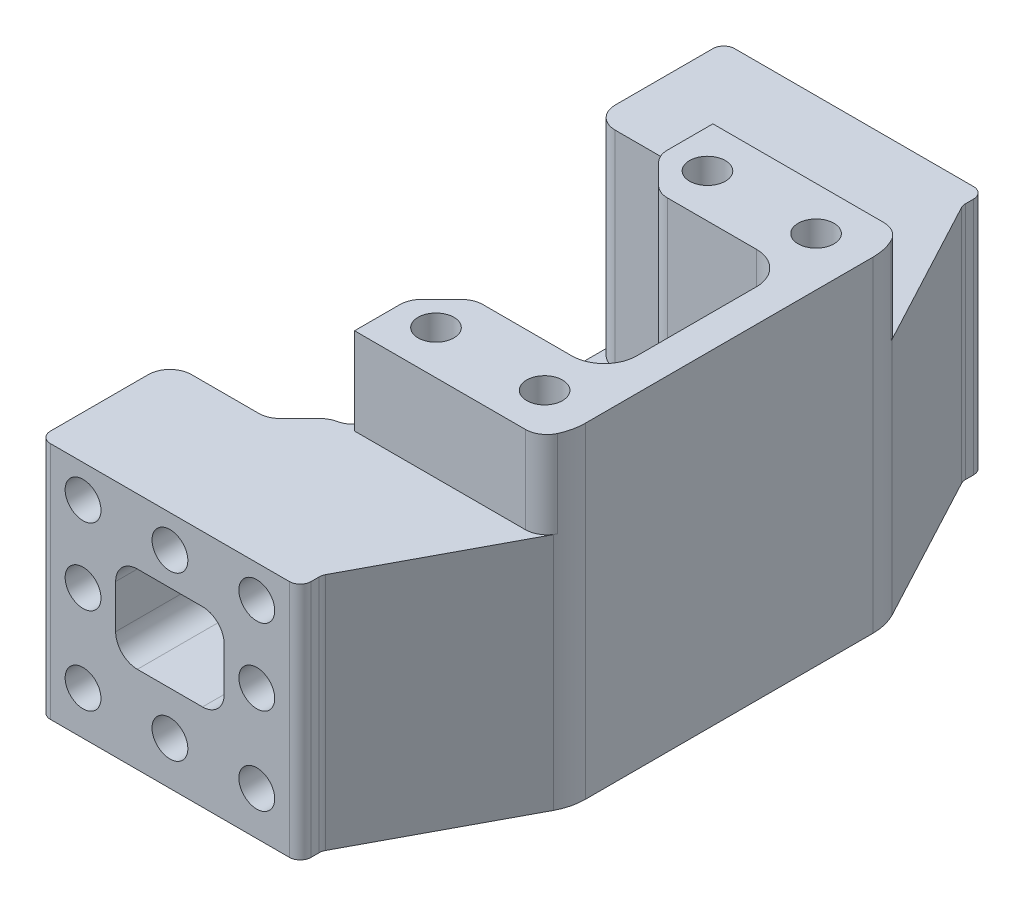
from build123d import *

# Parameters (mm, degrees)
SKETCH_1_W           = 25
SKETCH_1_H           = 25
EXTRUDE_1_DEPTH      = 59
SKETCH_2_R           = 1.65
CUT_EXTRUDE_1_DEPTH  = 10
CUT_EXTRUDE_START    = -10
SKETCH_3_R           = 1.65
CUT_EXTRUDE_2_DEPTH  = 10
SKETCH_4_R           = 1.65
CUT_EXTRUDE_3_DEPTH  = 30
SKETCH_7_W           = 51
SKETCH_7_H           = 17
CUT_EXTRUDE_5_DEPTH  = 2
SKETCH_8_W           = 18
SKETCH_8_H           = 17
CUT_EXTRUDE_6_DEPTH  = 36
SKETCH_10_R          = 1.65
SKETCH_10_W          = 18
SKETCH_10_H          = 17
CUT_EXTRUDE_8_DEPTH  = 4
SKETCH_13_W          = 2
SKETCH_13_H          = 9
CUT_EXTRUDE_11_DEPTH = 4
SKETCH_15_W          = 5
SKETCH_15_H          = 33
CUT_EXTRUDE_13_DEPTH = 8
CHAMFER_1_SIZE       = 3
FILLET_7_R           = 1
SKETCH_17_W          = 2
SKETCH_17_H          = 61.49877521
CUT_EXTRUDE_15_DEPTH = 32
SKETCH_18_W          = 23
SKETCH_18_H          = 59
CUT_EXTRUDE_16_DEPTH = 10
EXTRUDE_START        = -10
SKETCH_19_R          = 1.65
EXTRUDE_2_DEPTH      = 10
SKETCH_20_R          = 1.65
EXTRUDE_3_DEPTH      = 10
SKETCH_23_R          = 1.65
CUT_EXTRUDE_17_DEPTH = 10
SKETCH_24_R          = 1.65
CUT_EXTRUDE_18_DEPTH = 10
CUT_EXTRUDE_19_DEPTH = 30
FILLET_9_R           = 5
FILLET_10_R          = 3
EXTRUDE_4_DEPTH      = 9
SKETCH_26_R          = 1.65
CUT_EXTRUDE_20_DEPTH = 8
CUT_EXTRUDE_START_2  = -8
SKETCH_27_R          = 1.65
CUT_EXTRUDE_21_DEPTH = 8
EXTRUDE_START_2      = 2
SKETCH_28_W          = 24
SKETCH_28_H          = 15
SKETCH_28_R          = 1.65
EXTRUDE_5_DEPTH      = 2
SKETCH_29_W          = 24
SKETCH_29_H          = 15
SKETCH_29_R          = 1.65
EXTRUDE_6_DEPTH      = 2
FILLET_11_R          = 2
FILLET_13_R          = 1
SKETCH_30_R          = 1.65
EXTRUDE_7_DEPTH      = 19
FILLET_START         = 12.5
FILLET_14_DEPTH      = 15.5
FILLET_START_2       = -2.5
FILLET_14_2_DEPTH    = 15
EXTRUDE_8_DEPTH      = 7
SKETCH_33_R          = 1.65
CUT_EXTRUDE_22_DEPTH = 10
SKETCH_34_W          = 10
SKETCH_34_H          = 8
CUT_EXTRUDE_23_DEPTH = 10
SKETCH_35_R          = 1.65
SKETCH_35_W          = 10
SKETCH_35_H          = 8
CUT_EXTRUDE_24_DEPTH = 10
FILLET_15_R          = 2


with BuildPart() as part:
    # 草图1 → 凸台-拉伸1 (new body)
    with BuildSketch(Plane.XY):
        Rectangle(SKETCH_1_W, SKETCH_1_H)
    extrude(amount=EXTRUDE_1_DEPTH)

    # 草图2 → 切除-拉伸1 (cut)
    with BuildSketch(Plane(origin=(0, 0, 0), x_dir=(-1, 0, 0), z_dir=(0, 0, -1))):
        with Locations((7.5, 8.5)):
            Circle(SKETCH_2_R)
        with Locations((7.5, -3.5)):
            Circle(SKETCH_2_R)
        with Locations((-0.5, -3.5)):
            Circle(SKETCH_2_R)
        with Locations((-0.5, 8.5)):
            Circle(SKETCH_2_R)
    extrude(amount=-CUT_EXTRUDE_1_DEPTH, mode=Mode.SUBTRACT)

    # 草图3 → 切除-拉伸2 (cut)
    with BuildSketch(Plane.XY.offset(59).offset(CUT_EXTRUDE_START)):
        with Locations(Location((0.5, -3.5, 0), (0, 0, 180))):
            Circle(SKETCH_3_R)
        with Locations(Location((-7.5, -3.5, 0), (0, 0, 180))):
            Circle(SKETCH_3_R)
        with Locations(Location((-7.5, 8.5, 0), (0, 0, 180))):
            Circle(SKETCH_3_R)
        with Locations(Location((0.5, 8.5, 0), (0, 0, 180))):
            Circle(SKETCH_3_R)
    extrude(amount=CUT_EXTRUDE_2_DEPTH, mode=Mode.SUBTRACT)

    # 草图4 → 切除-拉伸3 (cut)
    with BuildSketch(Plane(origin=(0, 12.5, 0), x_dir=(1, 0, 0), z_dir=(0, 1, 0))):
        with Locations(Location((8, -17, 0), (0, 0, 270))):
            Circle(SKETCH_4_R)
        with Locations(Location((-2, -17, 0), (0, 0, 270))):
            Circle(SKETCH_4_R)
        with Locations(Location((-2, -42, 0), (0, 0, 270))):
            Circle(SKETCH_4_R)
        with Locations(Location((8, -42, 0), (0, 0, 270))):
            Circle(SKETCH_4_R)
    extrude(amount=-CUT_EXTRUDE_3_DEPTH, mode=Mode.SUBTRACT)

    # 草图7 → 切除-拉伸5 (cut)
    with BuildSketch(Plane.ZY.offset(12.5)):
        with Locations((29.5, 0)):
            Rectangle(SKETCH_7_W, SKETCH_7_H)
    extrude(amount=-CUT_EXTRUDE_5_DEPTH, mode=Mode.SUBTRACT)

    # 草图8 → 切除-拉伸6 (cut)
    with BuildSketch(Plane(origin=(0, 12.5, 0), x_dir=(1, 0, 0), z_dir=(0, 1, 0))):
        with Locations((0.5, -29.5)):
            Rectangle(SKETCH_8_W, SKETCH_8_H)
    extrude(amount=-CUT_EXTRUDE_6_DEPTH, mode=Mode.SUBTRACT)

    # 草图10 → 切除-拉伸8 (cut)
    with BuildSketch(Plane(origin=(0, 12.5, 0), x_dir=(1, 0, 0), z_dir=(0, 1, 0))):
        Polygon((-12.5, -13), (-12.5, -46), (11.433333333, -46), (12.5, -44), (12.5, -15), (11.433333333, -13), align=None)
        with Locations(Location((-2, -42, 0), (0, 0, 270))):
            Circle(SKETCH_10_R, mode=Mode.SUBTRACT)
        with Locations(Location((8, -42, 0), (0, 0, 270))):
            Circle(SKETCH_10_R, mode=Mode.SUBTRACT)
        with Locations(Location((-2, -17, 0), (0, 0, 270))):
            Circle(SKETCH_10_R, mode=Mode.SUBTRACT)
        with Locations((0.5, -29.5)):
            Rectangle(SKETCH_10_W, SKETCH_10_H, mode=Mode.SUBTRACT)
        with Locations(Location((8, -17, 0), (0, 0, 270))):
            Circle(SKETCH_10_R, mode=Mode.SUBTRACT)
    extrude(amount=-CUT_EXTRUDE_8_DEPTH, mode=Mode.SUBTRACT)

    # 草图13 → 切除-拉伸11 (cut)
    with BuildSketch(Plane(origin=(0, 12.5, 0), x_dir=(1, 0, 0), z_dir=(0, 1, 0))):
        with Locations((-11.5, -50.5)):
            Rectangle(SKETCH_13_W, SKETCH_13_H)
        with Locations((-11.5, -8.5)):
            Rectangle(SKETCH_13_W, SKETCH_13_H)
    extrude(amount=-CUT_EXTRUDE_11_DEPTH, mode=Mode.SUBTRACT)

    # 草图15 → 切除-拉伸13 (cut)
    with BuildSketch(Plane(origin=(0, 8.5, 0), x_dir=(1, 0, 0), z_dir=(0, 1, 0))):
        with Locations((-8, -29.5)):
            Rectangle(SKETCH_15_W, SKETCH_15_H)
    extrude(amount=-CUT_EXTRUDE_13_DEPTH, mode=Mode.SUBTRACT)

    # 倒角1
    chamfer_1_edges = [part.edges().sort_by_distance(p)[0] for p in [
        (-10.5, 6.5, 46),
        (-10.5, 6.5, 13),
        (-5.5, 4.5, 21),
        (-5.5, 4.5, 38),
    ]]
    chamfer(chamfer_1_edges, length=CHAMFER_1_SIZE)

    # 圆角7
    fillet_7_edges = [part.edges().sort_by_distance(p)[0] for p in [
        (-5.5, 4.5, 13),
        (-5.5, 4.5, 46),
    ]]
    fillet(fillet_7_edges, radius=FILLET_7_R)

    # 草图17 → 切除-拉伸15 (cut)
    with BuildSketch(Plane(origin=(0, 12.5, 0), x_dir=(1, 0, 0), z_dir=(0, 1, 0))):
        with Locations((-11.5, -29.775532147)):
            Rectangle(SKETCH_17_W, SKETCH_17_H)
    extrude(amount=-CUT_EXTRUDE_15_DEPTH, mode=Mode.SUBTRACT)

    # 草图18 → 切除-拉伸16 (cut)
    with BuildSketch(Plane.XZ.offset(12.5)):
        with Locations((1, 29.5)):
            Rectangle(SKETCH_18_W, SKETCH_18_H)
    extrude(amount=-CUT_EXTRUDE_16_DEPTH, mode=Mode.SUBTRACT)

    # 草图19 → 凸台-拉伸2 (add)
    with BuildSketch(Plane.XY.offset(59).offset(EXTRUDE_START)):
        with Locations(Location((0.5, 8.5, 0), (0, 0, 180))):
            Circle(SKETCH_19_R)
        with Locations(Location((-7.5, 8.5, 0), (0, 0, 180))):
            Circle(SKETCH_19_R)
        with BuildLine():
            Line((-8.812440475, -2.5), (-6.187559525, -2.5))
            ThreePointArc((-6.187559525, -2.5), (-7.5, -1.85), (-8.812440475, -2.5))
        make_face()
        with BuildLine():
            Line((-0.812440475, -2.5), (1.812440475, -2.5))
            ThreePointArc((1.812440475, -2.5), (0.5, -1.85), (-0.812440475, -2.5))
        make_face()
    extrude(amount=EXTRUDE_2_DEPTH)

    # 草图20 → 凸台-拉伸3 (add)
    with BuildSketch(Plane(origin=(0, 0, 0), x_dir=(-1, 0, 0), z_dir=(0, 0, -1))):
        with Locations((7.5, 8.5)):
            Circle(SKETCH_20_R)
        with Locations((-0.5, 8.5)):
            Circle(SKETCH_20_R)
        with BuildLine():
            Line((-1.812440475, -2.5), (0.812440475, -2.5))
            ThreePointArc((0.812440475, -2.5), (-0.5, -1.85), (-1.812440475, -2.5))
        make_face()
        with BuildLine():
            Line((6.187559525, -2.5), (8.812440475, -2.5))
            ThreePointArc((8.812440475, -2.5), (7.5, -1.85), (6.187559525, -2.5))
        make_face()
    extrude(amount=-EXTRUDE_3_DEPTH)

    # 草图23 → 切除-拉伸17 (cut)
    with BuildSketch(Plane(origin=(0, 0, 0), x_dir=(-1, 0, 0), z_dir=(0, 0, -1))):
        with Locations((7.5, 1.5)):
            Circle(SKETCH_23_R)
        with Locations((-0.5, 1.5)):
            Circle(SKETCH_23_R)
        with Locations((-0.5, 9.5)):
            Circle(SKETCH_23_R)
        with Locations((7.5, 9.5)):
            Circle(SKETCH_23_R)
    extrude(amount=-CUT_EXTRUDE_17_DEPTH, mode=Mode.SUBTRACT)

    # 草图24 → 切除-拉伸18 (cut)
    with BuildSketch(Plane.XY.offset(59).offset(CUT_EXTRUDE_START)):
        with Locations(Location((-7.5, 9.5, 0), (0, 0, 180))):
            Circle(SKETCH_24_R)
        with Locations(Location((-7.5, 1.5, 0), (0, 0, 180))):
            Circle(SKETCH_24_R)
        with Locations(Location((0.5, 1.5, 0), (0, 0, 180))):
            Circle(SKETCH_24_R)
        with Locations(Location((0.5, 9.5, 0), (0, 0, 180))):
            Circle(SKETCH_24_R)
    extrude(amount=CUT_EXTRUDE_18_DEPTH, mode=Mode.SUBTRACT)

    # 草图5 → 切除-拉伸19 (cut)
    with BuildSketch(Plane(origin=(0, 12.5, 0), x_dir=(1, 0, 0), z_dir=(0, 1, 0))):
        Polygon((4.5, 0), (12.5, 0), (12.5, -15), align=None)
        Polygon((12.5, -44), (4.5, -59), (12.5, -59), align=None)
    extrude(amount=-CUT_EXTRUDE_19_DEPTH, mode=Mode.SUBTRACT)

    # 圆角9
    fillet_9_edges = [part.edges().sort_by_distance(p)[0] for p in [
        (12.5, 3, 15),
        (12.5, 3, 44),
    ]]
    fillet(fillet_9_edges, radius=FILLET_9_R)

    # 圆角10
    fillet_10_edges = [part.edges().sort_by_distance(p)[0] for p in [
        (9.5, 3, 38),
        (-8.5, -1, 38),
        (9.5, 3, 21),
        (-8.5, -1, 21),
    ]]
    fillet(fillet_10_edges, radius=FILLET_10_R)

    # 草图25 → 凸台-拉伸4 (add)
    with BuildSketch(Plane.ZY.offset(10.5)):
        Polygon((0, 12.5), (0, -2.5), (59, -2.5), (59, 12.5), (49, 12.5), (49, 0.5), (10, 0.5), (10, 12.5), align=None)
    extrude(amount=EXTRUDE_4_DEPTH)

    # 草图26 → 切除-拉伸20 (cut)
    with BuildSketch(Plane(origin=(0, 0, 0), x_dir=(-1, 0, 0), z_dir=(0, 0, -1))):
        with Locations((15.5, 9.5)):
            Circle(SKETCH_26_R)
        with Locations((15.5, 1.5)):
            Circle(SKETCH_26_R)
    extrude(amount=-CUT_EXTRUDE_20_DEPTH, mode=Mode.SUBTRACT)

    # 草图27 → 切除-拉伸21 (cut)
    with BuildSketch(Plane.XY.offset(59).offset(CUT_EXTRUDE_START_2)):
        with Locations(Location((-15.5, 1.5, 0), (0, 0, 180))):
            Circle(SKETCH_27_R)
        with Locations(Location((-15.5, 9.5, 0), (0, 0, 180))):
            Circle(SKETCH_27_R)
    extrude(amount=CUT_EXTRUDE_21_DEPTH, mode=Mode.SUBTRACT)

    # 草图28 → 凸台-拉伸5 (add)
    with BuildSketch(Plane(origin=(0, 0, 0), x_dir=(-1, 0, 0), z_dir=(0, 0, -1)).offset(EXTRUDE_START_2)):
        with Locations((7.5, 5)):
            Rectangle(SKETCH_28_W, SKETCH_28_H)
        with Locations(Location((7.5, 1.5, 0), (0, 0, 180))):
            Circle(SKETCH_28_R, mode=Mode.SUBTRACT)
        with Locations(Location((-0.5, 1.5, 0), (0, 0, 180))):
            Circle(SKETCH_28_R, mode=Mode.SUBTRACT)
        with Locations(Location((-0.5, 9.5, 0), (0, 0, 180))):
            Circle(SKETCH_28_R, mode=Mode.SUBTRACT)
        with Locations(Location((7.5, 9.5, 0), (0, 0, 180))):
            Circle(SKETCH_28_R, mode=Mode.SUBTRACT)
        with Locations(Location((15.5, 1.5, 0), (0, 0, 180))):
            Circle(SKETCH_28_R, mode=Mode.SUBTRACT)
        with Locations(Location((15.5, 9.5, 0), (0, 0, 180))):
            Circle(SKETCH_28_R, mode=Mode.SUBTRACT)
    extrude(amount=-EXTRUDE_5_DEPTH)

    # 草图29 → 凸台-拉伸6 (add)
    with BuildSketch(Plane.XY.offset(59)):
        with Locations((-7.5, 5)):
            Rectangle(SKETCH_29_W, SKETCH_29_H)
        with Locations(Location((-7.5, 9.5, 0), (0, 0, 180))):
            Circle(SKETCH_29_R, mode=Mode.SUBTRACT)
        with Locations(Location((-7.5, 1.5, 0), (0, 0, 180))):
            Circle(SKETCH_29_R, mode=Mode.SUBTRACT)
        with Locations(Location((0.5, 1.5, 0), (0, 0, 180))):
            Circle(SKETCH_29_R, mode=Mode.SUBTRACT)
        with Locations(Location((0.5, 9.5, 0), (0, 0, 180))):
            Circle(SKETCH_29_R, mode=Mode.SUBTRACT)
        with Locations(Location((-15.5, 9.5, 0), (0, 0, 180))):
            Circle(SKETCH_29_R, mode=Mode.SUBTRACT)
        with Locations(Location((-15.5, 1.5, 0), (0, 0, 180))):
            Circle(SKETCH_29_R, mode=Mode.SUBTRACT)
    extrude(amount=EXTRUDE_6_DEPTH)

    # 圆角11
    fillet_11_edges = [part.edges().sort_by_distance(p)[0] for p in [
        (-2.5, 4.5, 21),
        (-5.5, 4.5, 18),
        (-2.5, 4.5, 38),
        (-5.5, 4.5, 41),
        (-7.5, 6.5, 46),
        (-10.5, 6.5, 10),
        (-10.5, 6.5, 49),
        (-7.5, 6.5, 13),
        (-19.5, 6.5, 49),
        (-19.5, 6.5, 10),
    ]]
    fillet(fillet_11_edges, radius=FILLET_11_R)

    # 圆角13
    fillet_13_edges = [part.edges().sort_by_distance(p)[0] for p in [
        (4.5, 5, 0),
        (4.5, 5, 59),
        (4.5, 5, -2),
        (-19.5, 5, -2),
        (-19.5, 5, 61),
        (4.5, 5, 61),
    ]]
    fillet(fillet_13_edges, radius=FILLET_13_R)

    # 草图30 → 凸台-拉伸7 (add)
    with BuildSketch(Plane(origin=(0, 8.5, 0), x_dir=(1, 0, 0), z_dir=(0, 1, 0))):
        with BuildLine():
            Line((-5.5, -13), (-5.5, -14))
            Line((-5.5, -14), (-5.5, -17.171572875))
            ThreePointArc((-5.5, -17.171572875), (-5.347759065, -17.93693974), (-4.914213562, -18.585786438))
            Line((-4.914213562, -18.585786438), (-3.085786438, -20.414213562))
            ThreePointArc((-3.085786438, -20.414213562), (-2.43693974, -20.847759065), (-1.671572875, -21))
            Line((-1.671572875, -21), (6.5, -21))
            ThreePointArc((6.5, -21), (8.621320344, -21.878679656), (9.5, -24))
            Line((9.5, -24), (9.5, -35))
            ThreePointArc((9.5, -35), (8.621320344, -37.121320344), (6.5, -38))
            Line((6.5, -38), (-1.671572875, -38))
            ThreePointArc((-1.671572875, -38), (-2.43693974, -38.152240935), (-3.085786438, -38.585786438))
            Line((-3.085786438, -38.585786438), (-4.914213562, -40.414213562))
            ThreePointArc((-4.914213562, -40.414213562), (-5.347759065, -41.06306026), (-5.5, -41.828427125))
            Line((-5.5, -41.828427125), (-5.5, -45))
            Line((-5.5, -45), (-5.5, -46))
            Line((-5.5, -46), (11.433333333, -46))
            Line((11.433333333, -46), (11.911764706, -45.102941176))
            ThreePointArc((11.911764706, -45.102941176), (12.350712501, -43.962678125), (12.5, -42.75))
            Line((12.5, -42.75), (12.5, -16.25))
            ThreePointArc((12.5, -16.25), (12.350712501, -15.037321875), (11.911764706, -13.897058824))
            Line((11.911764706, -13.897058824), (11.433333333, -13))
            Line((11.433333333, -13), (-5.5, -13))
        make_face()
        with Locations(Location((-2, -42, 0), (0, 0, 270))):
            Circle(SKETCH_30_R, mode=Mode.SUBTRACT)
        with Locations(Location((8, -42, 0), (0, 0, 270))):
            Circle(SKETCH_30_R, mode=Mode.SUBTRACT)
        with Locations(Location((-2, -17, 0), (0, 0, 270))):
            Circle(SKETCH_30_R, mode=Mode.SUBTRACT)
        with Locations(Location((8, -17, 0), (0, 0, 270))):
            Circle(SKETCH_30_R, mode=Mode.SUBTRACT)
    extrude(amount=EXTRUDE_7_DEPTH)

    # 圆角14: read off the stored shape, not the designer's step
    # 圆角14 outline → 圆角14 (cut)
    with BuildSketch(Plane(origin=(0, 0, 0), x_dir=(1, 0, 0), z_dir=(0, 1, 0)).offset(FILLET_START)):
        with BuildLine():
            ThreePointArc((12.045296714, -44.833333333), (11.307301478, -45.683250823), (10.227178029, -46))
            Line((10.227178029, -46), (11.433333333, -46))
            Line((11.433333333, -46), (11.911764706, -45.102941176))
            ThreePointArc((11.911764706, -45.102941176), (11.980559052, -44.969141857), (12.045296714, -44.833333333))
        make_face()
        with BuildLine():
            Line((11.433333333, -13), (10.227178029, -13))
            ThreePointArc((10.227178029, -13), (11.307301478, -13.316749177), (12.045296714, -14.166666667))
            ThreePointArc((12.045296714, -14.166666667), (11.980559052, -14.030858143), (11.911764706, -13.897058824))
            Line((11.911764706, -13.897058824), (11.433333333, -13))
        make_face()
    extrude(amount=FILLET_14_DEPTH, mode=Mode.SUBTRACT)

    # Fillet 14 2 outline → Fillet 14 2 (add)
    with BuildSketch(Plane(origin=(0, 0, 0), x_dir=(1, 0, 0), z_dir=(0, 1, 0)).offset(FILLET_START_2)):
        with BuildLine():
            ThreePointArc((-5.5, -44.086726626), (-5.946226026, -45.346006753), (-7.085786438, -46.043363313))
            ThreePointArc((-7.085786438, -46.043363313), (-6.879811472, -46.01087037), (-6.671572875, -46))
            Line((-6.671572875, -46), (-5.5, -46))
            Line((-5.5, -46), (-5.5, -44.086726626))
        make_face()
        with BuildLine():
            ThreePointArc((-7.085786438, -12.956636687), (-5.946226026, -13.653993247), (-5.5, -14.913273374))
            Line((-5.5, -14.913273374), (-5.5, -13))
            Line((-5.5, -13), (-6.671572875, -13))
            ThreePointArc((-6.671572875, -13), (-6.879811472, -12.98912963), (-7.085786438, -12.956636687))
        make_face()
    extrude(amount=FILLET_14_2_DEPTH)

    # 草图32 → 凸台-拉伸8 (add)
    with BuildSketch(Plane(origin=(0, 12.5, 0), x_dir=(1, 0, 0), z_dir=(0, 1, 0))):
        with BuildLine():
            Line((-19.5, -51), (-19.5, -60))
            ThreePointArc((-19.5, -60), (-19.207106781, -60.707106781), (-18.5, -61))
            Line((-18.5, -61), (3.5, -61))
            ThreePointArc((3.5, -61), (4.207106781, -60.707106781), (4.5, -60))
            Line((4.5, -60), (4.5, -59.25))
            ThreePointArc((4.5, -59.25), (4.5298575, -59.007464375), (4.617647059, -58.779411765))
            Line((4.617647059, -58.779411765), (11.911764706, -45.102941176))
            ThreePointArc((11.911764706, -45.102941176), (11.980559052, -44.969141857), (12.045296714, -44.833333333))
            ThreePointArc((12.045296714, -44.833333333), (11.307301478, -45.683250823), (10.227178029, -46))
            Line((10.227178029, -46), (-5.5, -46))
            Line((-5.5, -46), (-5.5, -44.086726626))
            ThreePointArc((-5.5, -44.086726626), (-5.946226026, -45.346006753), (-7.085786438, -46.043363313))
            ThreePointArc((-7.085786438, -46.043363313), (-7.625167207, -46.241973308), (-8.085786438, -46.585786438))
            Line((-8.085786438, -46.585786438), (-9.914213562, -48.414213562))
            ThreePointArc((-9.914213562, -48.414213562), (-10.56306026, -48.847759065), (-11.328427125, -49))
            Line((-11.328427125, -49), (-17.5, -49))
            ThreePointArc((-17.5, -49), (-18.914213562, -49.585786438), (-19.5, -51))
        make_face()
        with BuildLine():
            Line((3.5, 2), (-18.5, 2))
            ThreePointArc((-18.5, 2), (-19.207106781, 1.707106781), (-19.5, 1))
            Line((-19.5, 1), (-19.5, -8))
            ThreePointArc((-19.5, -8), (-18.914213562, -9.414213562), (-17.5, -10))
            Line((-17.5, -10), (-11.328427125, -10))
            ThreePointArc((-11.328427125, -10), (-10.56306026, -10.152240935), (-9.914213562, -10.585786438))
            Line((-9.914213562, -10.585786438), (-8.085786438, -12.414213562))
            ThreePointArc((-8.085786438, -12.414213562), (-7.625167207, -12.758026692), (-7.085786438, -12.956636687))
            ThreePointArc((-7.085786438, -12.956636687), (-5.946226026, -13.653993247), (-5.5, -14.913273374))
            Line((-5.5, -14.913273374), (-5.5, -13))
            Line((-5.5, -13), (10.227178029, -13))
            ThreePointArc((10.227178029, -13), (11.307301478, -13.316749177), (12.045296714, -14.166666667))
            ThreePointArc((12.045296714, -14.166666667), (11.980559052, -14.030858143), (11.911764706, -13.897058824))
            Line((11.911764706, -13.897058824), (4.617647059, -0.220588235))
            ThreePointArc((4.617647059, -0.220588235), (4.5298575, 0.007464375), (4.5, 0.25))
            Line((4.5, 0.25), (4.5, 1))
            ThreePointArc((4.5, 1), (4.207106781, 1.707106781), (3.5, 2))
        make_face()
    extrude(amount=EXTRUDE_8_DEPTH)

    # 草图33 → 切除-拉伸22 (cut)
    with BuildSketch(Plane(origin=(0, 0, -2), x_dir=(-1, 0, 0), z_dir=(0, 0, -1))):
        with Locations((15.5, 16.5)):
            Circle(SKETCH_33_R)
        with Locations((7.5, 16.5)):
            Circle(SKETCH_33_R)
        with Locations((-0.5, 16.5)):
            Circle(SKETCH_33_R)
    extrude(amount=-CUT_EXTRUDE_22_DEPTH, mode=Mode.SUBTRACT)

    # 草图34 → 切除-拉伸23 (cut)
    with BuildSketch(Plane(origin=(0, 0, -2), x_dir=(-1, 0, 0), z_dir=(0, 0, -1))):
        with Locations((7.5, 9.5)):
            Rectangle(SKETCH_34_W, SKETCH_34_H)
    extrude(amount=-CUT_EXTRUDE_23_DEPTH, mode=Mode.SUBTRACT)

    # 草图35 → 切除-拉伸24 (cut)
    with BuildSketch(Plane.XY.offset(61).offset(CUT_EXTRUDE_START)):
        with Locations(Location((0.5, 16.5, 0), (0, 0, 180))):
            Circle(SKETCH_35_R)
        with Locations(Location((-7.5, 16.5, 0), (0, 0, 180))):
            Circle(SKETCH_35_R)
        with Locations(Location((-15.5, 16.5, 0), (0, 0, 180))):
            Circle(SKETCH_35_R)
        with Locations((-7.5, 9.5)):
            Rectangle(SKETCH_35_W, SKETCH_35_H)
    extrude(amount=CUT_EXTRUDE_24_DEPTH, mode=Mode.SUBTRACT)

    # 圆角15
    fillet_15_edges = [part.edges().sort_by_distance(p)[0] for p in [
        (-12.5, 13.5, 3),
        (-12.5, 5.5, 3),
        (-2.5, 5.5, 3),
        (-2.5, 13.5, 3),
        (-2.5, 5.5, 56),
        (-12.5, 5.5, 56),
        (-12.5, 13.5, 56),
        (-2.5, 13.5, 56),
    ]]
    fillet(fillet_15_edges, radius=FILLET_15_R)


solid = part.part
